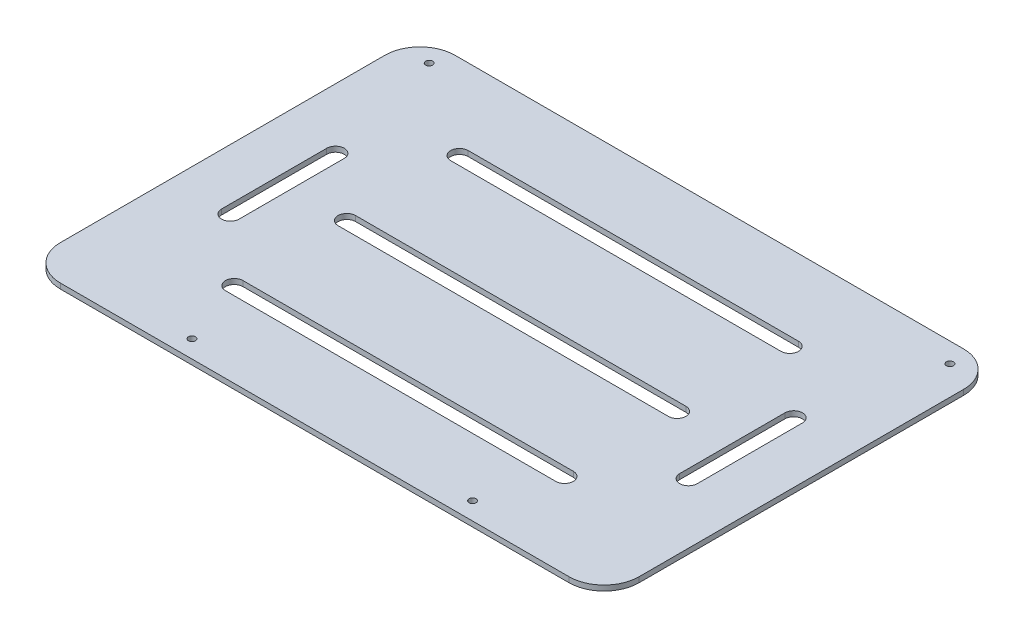
from build123d import *

# Parameters (mm, degrees)
SKETCH_1_W          = 330
SKETCH_1_H          = 225
EXTRUDE_1_DEPTH     = 3
SKETCH_3_R          = 2
CUT_EXTRUDE_1_DEPTH = 225.719219269
CUT_EXTRUDE_2_DEPTH = 225.719219269
CUT_EXTRUDE_3_DEPTH = 225.719219269
CUT_EXTRUDE_4_DEPTH = 225.719219269
FILLET_1_R          = 20


with BuildPart() as part:
    # 草图1 → 凸台-拉伸1 (new body)
    with BuildSketch(Plane(origin=(0, 0, 0), x_dir=(1, 0, 0), z_dir=(0, 1, 0))):
        with Locations((19.411764706, 15.882352941)):
            Rectangle(SKETCH_1_W, SKETCH_1_H)
    extrude(amount=EXTRUDE_1_DEPTH)

    # 草图3 → 切除-拉伸1 (cut, through all)
    with BuildSketch(Plane(origin=(0, 3, 0), x_dir=(1, 0, 0), z_dir=(0, 1, 0))):
        with Locations((-129.063688438, 117.115616448)):
            Circle(SKETCH_3_R)
        with Locations((167.88721785, 117.115616448)):
            Circle(SKETCH_3_R)
        with Locations((-60.588235294, -86.617647059)):
            Circle(SKETCH_3_R)
        with Locations((99.411764706, -86.617647059)):
            Circle(SKETCH_3_R)
    extrude(amount=-CUT_EXTRUDE_1_DEPTH, mode=Mode.SUBTRACT)

    # 草图4 → 切除-拉伸2 (cut, through all)
    with BuildSketch(Plane(origin=(0, 3, 0), x_dir=(1, 0, 0), z_dir=(0, 1, 0))):
        with BuildLine():
            Line((-116.235231271, -14.117647059), (-116.235231271, 45.882352941))
            ThreePointArc((-116.235231271, 45.882352941), (-111.235231271, 50.882352941), (-106.235231271, 45.882352941))
            Line((-106.235231271, 45.882352941), (-106.235231271, -14.117647059))
            ThreePointArc((-106.235231271, -14.117647059), (-111.235231271, -19.117647059), (-116.235231271, -14.117647059))
        make_face()
        with BuildLine():
            Line((155.058760683, -14.117647059), (155.058760683, 45.882352941))
            ThreePointArc((155.058760683, 45.882352941), (150.058760683, 50.882352941), (145.058760683, 45.882352941))
            Line((145.058760683, 45.882352941), (145.058760683, -14.117647059))
            ThreePointArc((145.058760683, -14.117647059), (150.058760683, -19.117647059), (155.058760683, -14.117647059))
        make_face()
    extrude(amount=-CUT_EXTRUDE_2_DEPTH, mode=Mode.SUBTRACT)

    # 草图5 → 切除-拉伸3 (cut, through all)
    with BuildSketch(Plane(origin=(0, 3, 0), x_dir=(1, 0, 0), z_dir=(0, 1, 0))):
        with BuildLine():
            Line((-74.774602087, 85.1003303), (113.598131499, 85.1003303))
            ThreePointArc((113.598131499, 85.1003303), (118.598131499, 80.1003303), (113.598131499, 75.1003303))
            Line((113.598131499, 75.1003303), (-74.774602087, 75.1003303))
            ThreePointArc((-74.774602087, 75.1003303), (-79.774602087, 80.1003303), (-74.774602087, 85.1003303))
        make_face()
        with BuildLine():
            Line((-74.774602087, -53.335624418), (113.598131499, -53.335624418))
            ThreePointArc((113.598131499, -53.335624418), (118.598131499, -48.335624418), (113.598131499, -43.335624418))
            Line((113.598131499, -43.335624418), (-74.774602087, -43.335624418))
            ThreePointArc((-74.774602087, -43.335624418), (-79.774602087, -48.335624418), (-74.774602087, -53.335624418))
        make_face()
    extrude(amount=-CUT_EXTRUDE_3_DEPTH, mode=Mode.SUBTRACT)

    # 草图6 → 切除-拉伸4 (cut, through all)
    with BuildSketch(Plane(origin=(0, 3, 0), x_dir=(1, 0, 0), z_dir=(0, 1, 0))):
        with BuildLine():
            Line((-74.773235294, 20.882352941), (113.596764706, 20.882352941))
            ThreePointArc((113.596764706, 20.882352941), (118.596764706, 15.882352941), (113.596764706, 10.882352941))
            Line((113.596764706, 10.882352941), (-74.773235294, 10.882352941))
            ThreePointArc((-74.773235294, 10.882352941), (-79.773235294, 15.882352941), (-74.773235294, 20.882352941))
        make_face()
    extrude(amount=-CUT_EXTRUDE_4_DEPTH, mode=Mode.SUBTRACT)

    # 圆角1
    fillet_1_edges = [part.edges().sort_by_distance(p)[0] for p in [
        (184.411764706, 1.5, 96.617647059),
        (184.411764706, 1.5, -128.382352941),
        (-145.588235294, 1.5, -128.382352941),
        (-145.588235294, 1.5, 96.617647059),
    ]]
    fillet(fillet_1_edges, radius=FILLET_1_R)


solid = part.part
